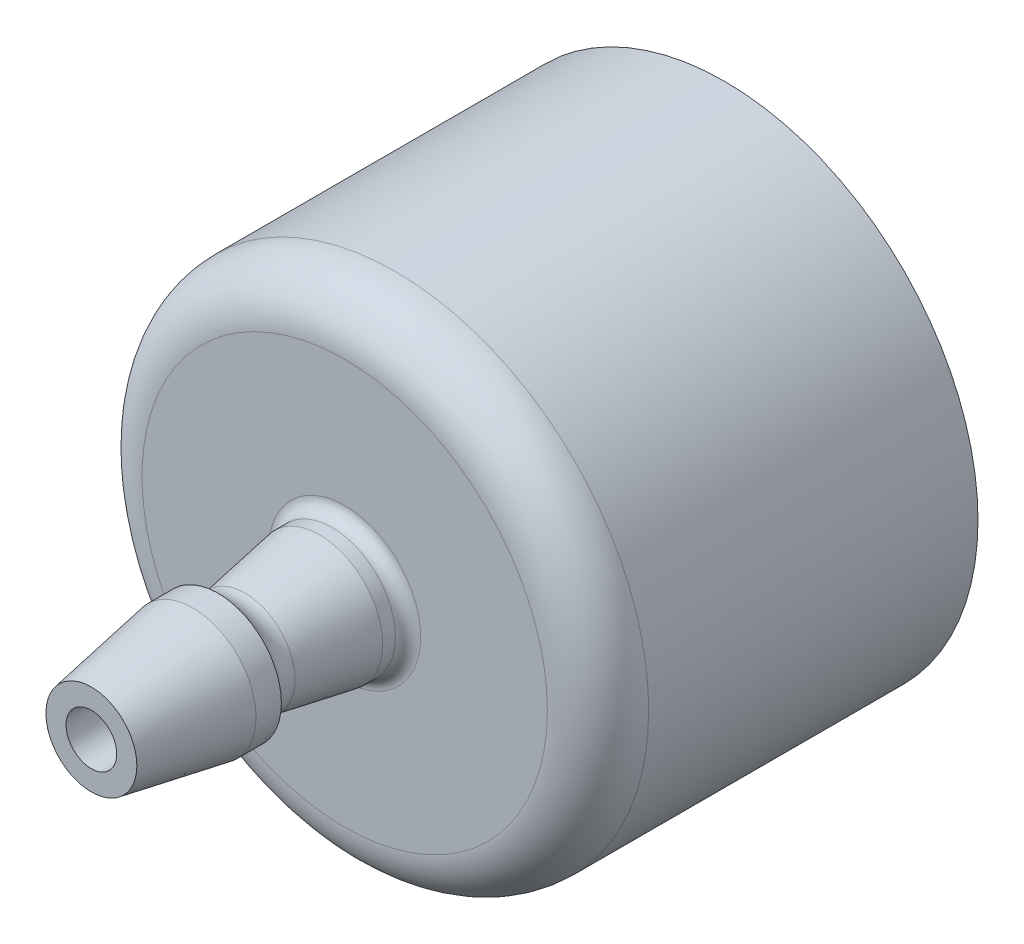
from build123d import *

# Parameters (mm, degrees)
SKETCH1_R                   = 2.5
SKETCH1_R_2                 = 1
BOSS_EXTRUDE1_DEPTH         = 5
CHAMFER2_SIZE               = 4
CHAMFER2_SIZE2              = 0.705307923
LPATTERN2_COUNT             = 2
LPATTERN2_PITCH             = 5
CHAMFER2_OF_LPATTERN2_SIZE2 = 0.705307923
CHAMFER2_OF_LPATTERN2_SIZE  = 4
FILLET1_R                   = 1
SKETCH2_R                   = 10
BOSS_EXTRUDE2_DEPTH         = 15
CUT_EXTRUDE1_START          = -2
SKETCH3_R                   = 8
CUT_EXTRUDE1_DEPTH          = 15
CUT_EXTRUDE2_START          = -15
SKETCH4_R                   = 1
CUT_EXTRUDE2_DEPTH          = 15
FILLET2_R                   = 2
FILLET3_R                   = 2
FILLET4_R                   = 0.5
FILLET5_R                   = 0.5


with BuildPart() as part:
    # Sketch1 → Boss-Extrude1 (new body)
    with BuildSketch(Plane.XY):
        Circle(SKETCH1_R)
        Circle(SKETCH1_R_2, mode=Mode.SUBTRACT)
    boss_extrude1 = extrude(amount=BOSS_EXTRUDE1_DEPTH)

    # Chamfer2
    chamfer2_edges = [part.edges().sort_by_distance(p)[0] for p in [
        (-2.5, 0, 5),
    ]]
    chamfer2_side = [part.faces().sort_by_distance(p)[0] for p in [
        (-2.5, 0, 2.5),
    ]]
    chamfer(chamfer2_edges, length=CHAMFER2_SIZE, length2=CHAMFER2_SIZE2, reference=chamfer2_side[0])


with BuildPart() as lpattern2_1:
    # LPattern2: Boss-Extrude1 ×2
    with Locations(*[(0, 0, i * LPATTERN2_PITCH) for i in range(1, LPATTERN2_COUNT)]):
        add(boss_extrude1)

    # Chamfer2 of LPattern2
    chamfer2_of_lpattern2_edges = [lpattern2_1.edges().sort_by_distance(p)[0] for p in [
        (-2.5, 0, 10),
    ]]
    chamfer(chamfer2_of_lpattern2_edges, length=CHAMFER2_OF_LPATTERN2_SIZE, length2=CHAMFER2_OF_LPATTERN2_SIZE2)


with BuildPart() as part_1:
    add(part.part)

    # LPattern2 united with what the copies to: union LPattern2_1
    add(lpattern2_1.part)

    # Fillet1
    # the kernel refuses this fillet: 1 mm, written as the material it adds along each edge
    with BuildSketch(Plane(origin=(0, 0, 5), x_dir=(1, 0, 0), z_dir=(0, -1, 0))) as fillet1_piece_1:
        with BuildLine():
            CenterArc((2.96611905, -0.884722008), FILLET1_R, 117.782669079, 72.217330921)
            Line((1.981311297, -1.058370186), (1.961615141, -1.061843149))
            Line((1.961615141, -1.061843149), (1.774995922, -0.003472964))
            Line((1.774995922, -0.003472964), (1.794692077, 0.02))
            ThreePointArc((1.794692077, 0.02), (2.147346039, 0.02), (2.490677619, 0.01769444))
            Line((2.490677619, 0.01769444), (2.5, 0))
        make_face()
    revolve(axis=Axis((0, 0, 5), (0, 0, 1)))

    # Sketch2 → Boss-Extrude2 (add)
    with BuildSketch(Plane.XY):
        Circle(SKETCH2_R)
    extrude(amount=-BOSS_EXTRUDE2_DEPTH)

    # Sketch3 → Cut-Extrude1 (cut)
    with BuildSketch(Plane.XY.offset(CUT_EXTRUDE1_START)):
        Circle(SKETCH3_R)
    extrude(amount=-CUT_EXTRUDE1_DEPTH, mode=Mode.SUBTRACT)

    # Sketch4 → Cut-Extrude2 (cut)
    with BuildSketch(Plane.XY.offset(CUT_EXTRUDE2_START)):
        Circle(SKETCH4_R)
    extrude(amount=CUT_EXTRUDE2_DEPTH, mode=Mode.SUBTRACT)

    # Fillet2
    fillet2_edges = [part_1.edges().sort_by_distance(p)[0] for p in [
        (-1, 0, -2),
    ]]
    fillet(fillet2_edges, radius=FILLET2_R)

    # Fillet3
    fillet3_edges = [part_1.edges().sort_by_distance(p)[0] for p in [
        (-10, 0, 0),
    ]]
    fillet(fillet3_edges, radius=FILLET3_R)

    # Fillet4
    fillet4_edges = [part_1.edges().sort_by_distance(p)[0] for p in [
        (-2.5, 0, 0),
    ]]
    fillet(fillet4_edges, radius=FILLET4_R)

    # Fillet5
    fillet5_edges = [part_1.edges().sort_by_distance(p)[0] for p in [
        (-8, 0, -15),
    ]]
    fillet(fillet5_edges, radius=FILLET5_R)


solid = part_1.part
